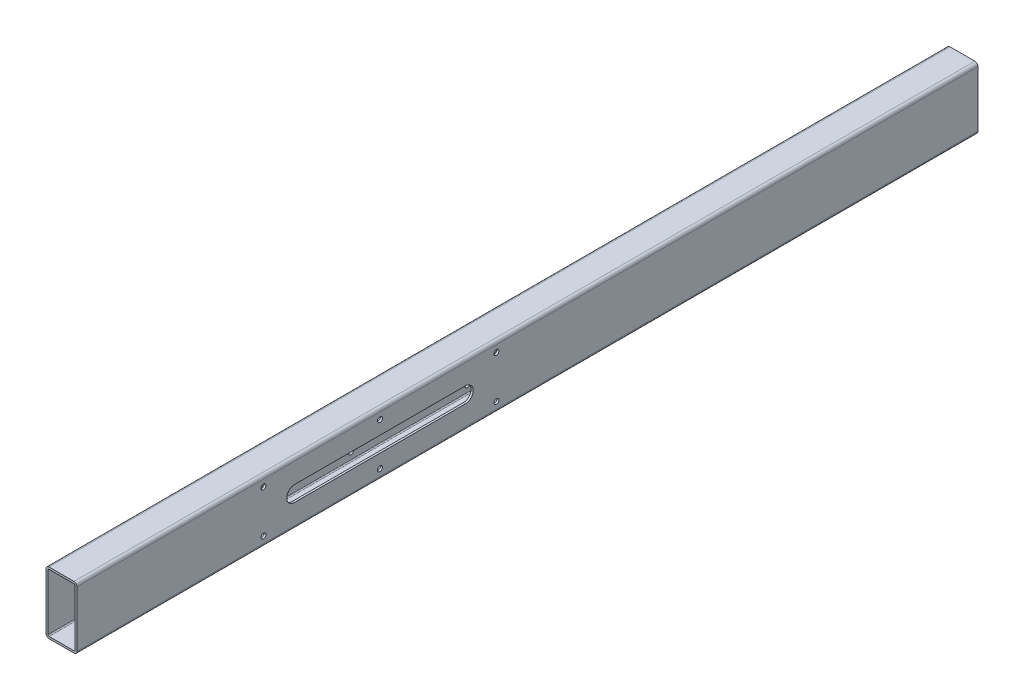
from build123d import *

# Parameters (mm, degrees)
EXTRUDE_THIN1_DEPTH = 368.3
CUT_EXTRUDE2_DEPTH  = 371.047578022
SKETCH5_R           = 2.0193
CUT_EXTRUDE3_DEPTH  = 371.047578022


with BuildPart() as part:
    # Sketch1 → Extrude-Thin1 (new, symmetric)
    with BuildSketch(Plane.XY):
        with BuildLine():
            Line((-10.16, 25.4), (10.16, 25.4))
            ThreePointArc((10.16, 25.4), (11.956051224, 24.656051224), (12.7, 22.86))
            Line((12.7, 22.86), (12.7, -22.86))
            ThreePointArc((12.7, -22.86), (11.956051224, -24.656051224), (10.16, -25.4))
            Line((10.16, -25.4), (-10.16, -25.4))
            ThreePointArc((-10.16, -25.4), (-11.956051224, -24.656051224), (-12.7, -22.86))
            Line((-12.7, -22.86), (-12.7, 22.86))
            ThreePointArc((-12.7, 22.86), (-11.956051224, 24.656051224), (-10.16, 25.4))
        make_face()
        with BuildLine():
            Line((-10.16, 23.749), (10.16, 23.749))
            ThreePointArc((10.16, 23.749), (10.788617928, 23.488617928), (11.049, 22.86))
            Line((11.049, 22.86), (11.049, -22.86))
            ThreePointArc((11.049, -22.86), (10.788617928, -23.488617928), (10.16, -23.749))
            Line((10.16, -23.749), (-10.16, -23.749))
            ThreePointArc((-10.16, -23.749), (-10.788617928, -23.488617928), (-11.049, -22.86))
            Line((-11.049, -22.86), (-11.049, 22.86))
            ThreePointArc((-11.049, 22.86), (-10.788617928, 23.488617928), (-10.16, 23.749))
        make_face(mode=Mode.SUBTRACT)
    extrude(amount=EXTRUDE_THIN1_DEPTH, both=True)

    # Sketch3 → Cut-Extrude2 (cut, through all)
    with BuildSketch(Plane.ZY.offset(12.7)):
        with BuildLine():
            Line((190.5, -6.35), (50.8, -6.35))
            ThreePointArc((50.8, -6.35), (44.45, 0), (50.8, 6.35))
            Line((50.8, 6.35), (190.5, 6.35))
            ThreePointArc((190.5, 6.35), (196.85, 0), (190.5, -6.35))
        make_face()
    extrude(amount=-CUT_EXTRUDE2_DEPTH, mode=Mode.SUBTRACT)

    # Sketch5 → Cut-Extrude3 (cut, through all)
    with BuildSketch(Plane(origin=(12.7, 0, 0), x_dir=(0, 0, -1), z_dir=(1, 0, 0))):
        with Locations((-25.4, 17.399)):
            Circle(SKETCH5_R)
        with Locations((-25.4, -17.399)):
            Circle(SKETCH5_R)
        with Locations((-120.65, 17.399)):
            Circle(SKETCH5_R)
        with Locations((-120.65, -17.399)):
            Circle(SKETCH5_R)
        with Locations((-215.9, -17.399)):
            Circle(SKETCH5_R)
        with Locations((-215.9, 17.399)):
            Circle(SKETCH5_R)
    extrude(amount=-CUT_EXTRUDE3_DEPTH, mode=Mode.SUBTRACT)


solid = part.part
